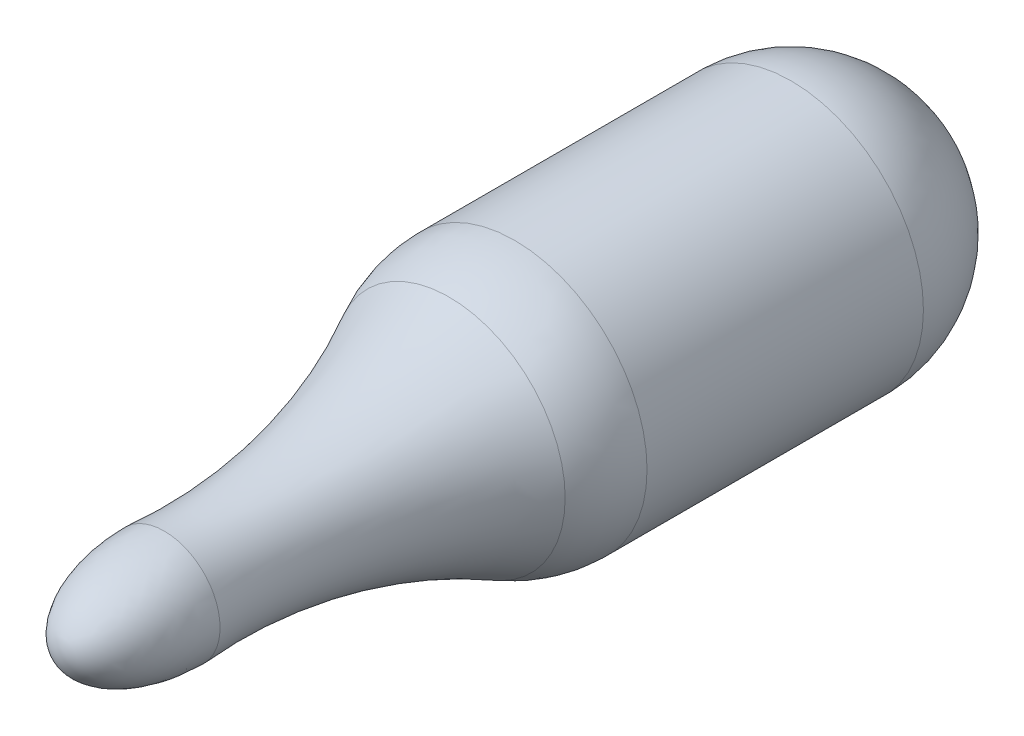
from build123d import *

# Parameters (mm, degrees)
CUT_EXTRUDE2_START  = -45
SKETCH2_R           = 6.35
CUT_EXTRUDE2_DEPTH  = 68.263083904
SKETCH6_R           = 6.35
SKETCH6_R_2         = 4.7625
BOSS_EXTRUDE3_DEPTH = 22.86
FILLET2_R           = 0.3175


with BuildPart() as part:
    # Sketch1 → Revolve1 (revolve)
    with BuildSketch(Plane(origin=(0, 0, 0), x_dir=(0, 0, -1), z_dir=(0, 1, 0))):
        with BuildLine():
            Line((-15, 0), (109, 0))
            ThreePointArc((109, 0), (103.435028843, 13.435028843), (90, 19))
            Line((90, 19), (50.312566576, 19))
            ThreePointArc((50.312566576, 19), (45.46484169, 18.403596662), (40.906236735, 16.649956343))
            ThreePointArc((40.906236735, 16.649956343), (21.06807377, 9.416811899), (0, 8))
            add(Edge.make_bspline(
                [(0, 8), (-15, 8), (-15, 0)],
                knots=[4.71238898, 4.71238898, 4.71238898, 6.283185307, 6.283185307, 6.283185307], degree=2, weights=[1, 0.707106781, 1]))
        make_face()
    revolve(axis=Axis((0, 0, 15), (0, 0, -1)))

    # Sketch2 → Cut-Extrude2 (cut, through all)
    with BuildSketch(Plane.XY.offset(CUT_EXTRUDE2_START)):
        Circle(SKETCH2_R)
    extrude(amount=-CUT_EXTRUDE2_DEPTH, mode=Mode.SUBTRACT)

    # Sketch6 → Boss-Extrude3 (add)
    with BuildSketch(Plane(origin=(0, 0, -45), x_dir=(-1, 0, 0), z_dir=(0, 0, -1))):
        Circle(SKETCH6_R)
        Circle(SKETCH6_R_2, mode=Mode.SUBTRACT)
    extrude(amount=BOSS_EXTRUDE3_DEPTH)

    # Fillet2
    fillet2_edges = [part.edges().sort_by_distance(p)[0] for p in [
        (0, -6.35, -107.907470508),
        (-6.35, 0, -67.86),
        (4.7625, 0, -67.86),
        (4.7625, 0, -45),
    ]]
    fillet(fillet2_edges, radius=FILLET2_R)


solid = part.part
